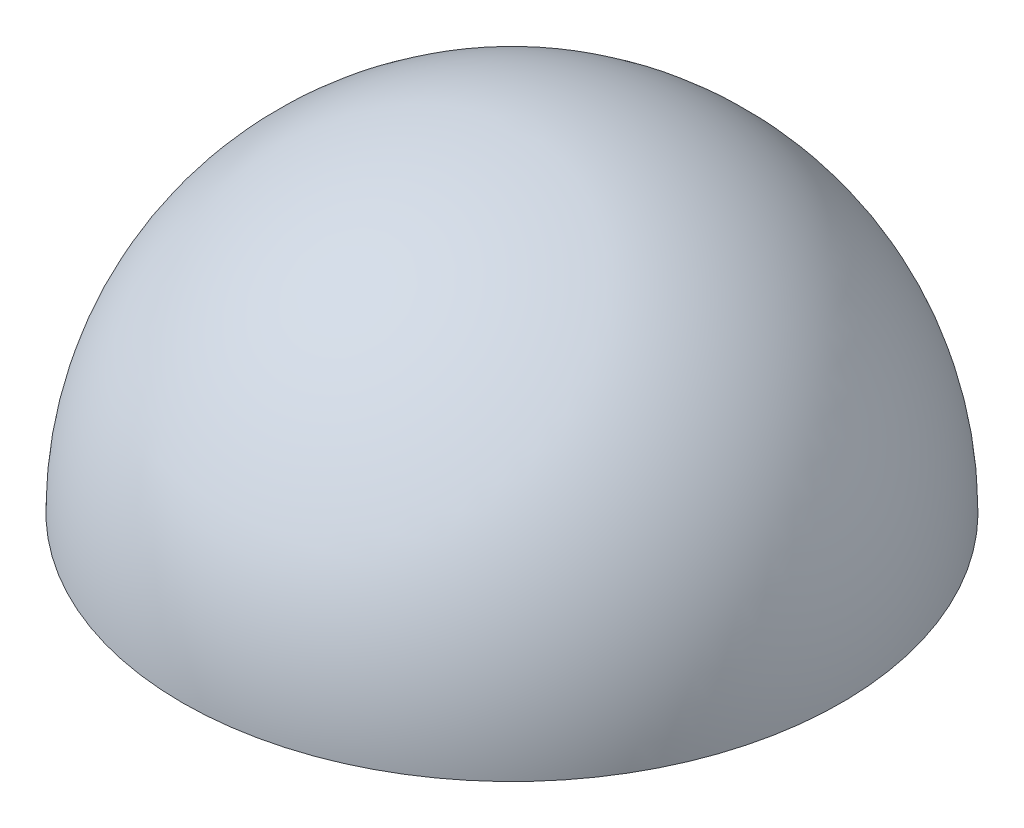
from build123d import *

# Parameters (mm, degrees)
REVOLVE1_ANGLE     = 180
SKETCH2_R          = 0.875
CUT_EXTRUDE1_DEPTH = 6


with BuildPart() as part:
    # Sketch1 → Revolve1 (revolve)
    with BuildSketch(Plane(origin=(0, 76.75, 0), x_dir=(-1, 0, 0), z_dir=(0, -1, 0))):
        with BuildLine():
            Line((-13.5, -0.25), (7, -0.25))
            ThreePointArc((7, -0.25), (-3.25, -10.5), (-13.5, -0.25))
        make_face()
    revolve(axis=Axis((13.5, 76.75, 0.25), (-1, 0, 0)), revolution_arc=REVOLVE1_ANGLE)

    # Sketch2 → Cut-Extrude1 (cut)
    with BuildSketch(Plane.XZ.offset(-76.75)):
        with Locations((3.25, 0.25)):
            Circle(SKETCH2_R)
    extrude(amount=-CUT_EXTRUDE1_DEPTH, mode=Mode.SUBTRACT)


solid = part.part
